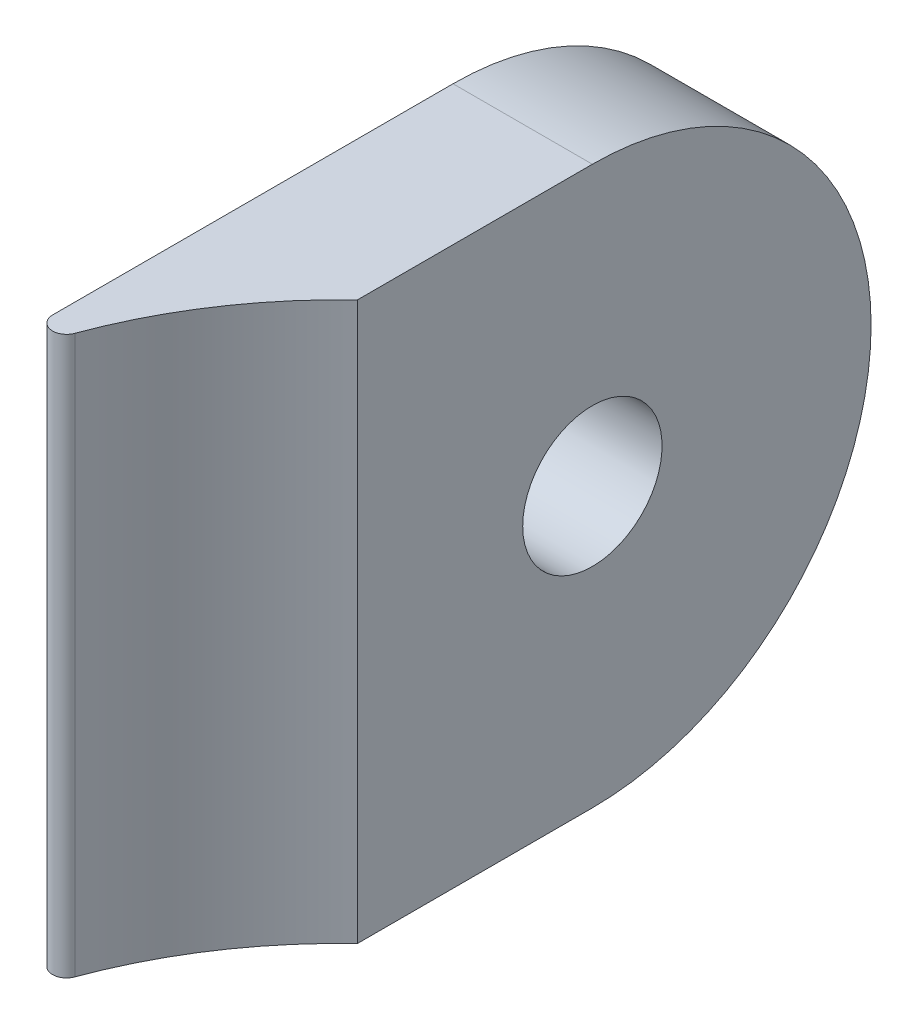
from build123d import *

# Parameters (mm, degrees)
BOSS_EXTRUDE1_DEPTH = 20
FILLET1_R           = 10
SKETCH2_R           = 2.5000000000000018
CUT_EXTRUDE1_DEPTH  = 37.40054944640259
FILLET2_R           = 0.5


with BuildPart() as part:
    # Sketch1 → Boss-Extrude1 (new body)
    with BuildSketch(Plane(origin=(0, 0, 0), x_dir=(1, 0, 0), z_dir=(0, 1, 0))):
        with BuildLine():
            Line((-15.875000000000004, 0), (-15.875, 30))
            Line((-15.875, 30), (-10.875, 30))
            Line((-10.875, 30), (-10.874999999999996, 11.565033506220383))
            ThreePointArc((-10.874999999999996, 11.565033506220383), (-14.57148328070962, 6.299801584177079), (-15.875000000000004, 0))
        make_face()
    extrude(amount=BOSS_EXTRUDE1_DEPTH)

    # Fillet1
    fillet1_edges = [part.edges().sort_by_distance(p)[0] for p in [
        (-13.375, 0, -30),
        (-13.375, 20, -30),
    ]]
    fillet(fillet1_edges, radius=FILLET1_R - 0.0001)  # a hair under: the kernel refuses the full size

    # Sketch2 → Cut-Extrude1 (cut, through all)
    with BuildSketch(Plane.ZY.offset(15.875000000000004)):
        with Locations((-19.999999999999996, 10)):
            Circle(SKETCH2_R)
    extrude(amount=-CUT_EXTRUDE1_DEPTH, mode=Mode.SUBTRACT)

    # Fillet2
    fillet2_edges = [part.edges().sort_by_distance(p)[0] for p in [
        (-15.875000000000004, 10, 2.2e-16),
    ]]
    fillet(fillet2_edges, radius=FILLET2_R)


solid = part.part
